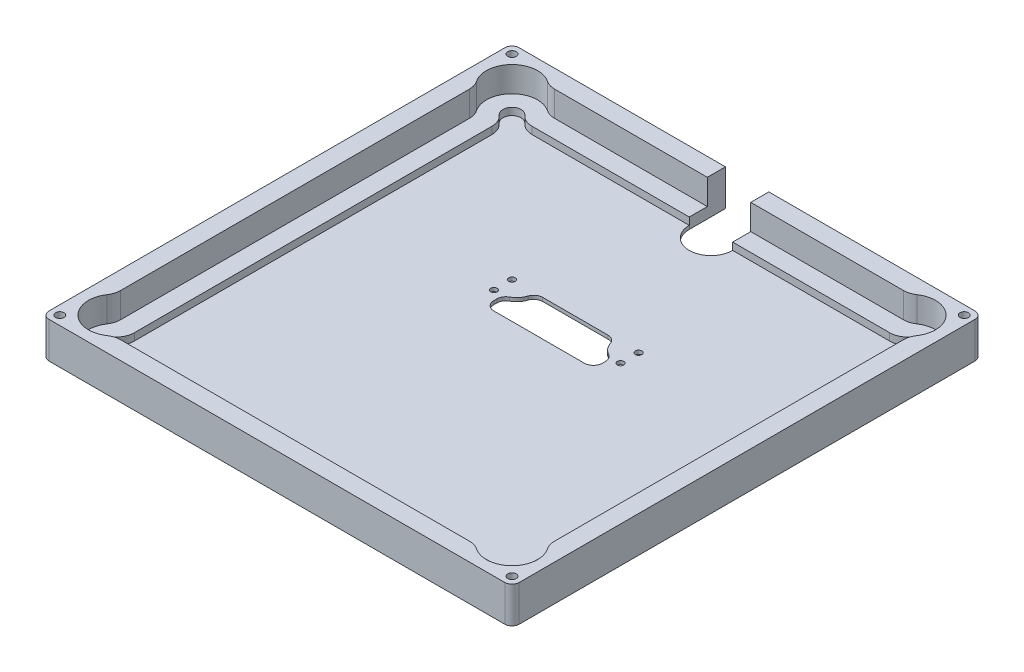
from build123d import *

# Parameters (mm, degrees)
SKETCH2_W           = 165.1
SKETCH2_H           = 165.1
BOSS_EXTRUDE1_DEPTH = 12.7
SKETCH3_W           = 152.4
SKETCH3_H           = 152.4
CUT_EXTRUDE1_DEPTH  = 8.9027
SKETCH4_W           = 139.7
SKETCH4_H           = 139.7
CUT_EXTRUDE2_DEPTH  = 2.54
SKETCH5_R           = 1.1303
CUT_EXTRUDE4_DEPTH  = 234.766882563
SKETCH6_R           = 1.4732
CUT_EXTRUDE5_DEPTH  = 234.831798522
FILLET2_R           = 2.54
CUT_EXTRUDE6_DEPTH  = 234.831798522
CUT_EXTRUDE11_DEPTH = 8.9027
SKETCH9_R           = 3.175
CUT_EXTRUDE12_DEPTH = 2.54
FILLET3_R           = 6.35
FILLET4_R           = 6.35
FILLET5_START       = -1
FILLET5_DEPTH       = 3
FILLET6_R           = 3.175


with BuildPart() as part:
    # Sketch2 → Boss-Extrude1 (new body)
    with BuildSketch(Plane(origin=(0, 0, 0), x_dir=(1, 0, 0), z_dir=(0, 1, 0))):
        with Locations((82.55, 82.55)):
            Rectangle(SKETCH2_W, SKETCH2_H)
    extrude(amount=BOSS_EXTRUDE1_DEPTH)

    # Sketch3 → Cut-Extrude1 (cut)
    with BuildSketch(Plane(origin=(0, 12.7, 0), x_dir=(1, 0, 0), z_dir=(0, 1, 0))):
        with Locations((82.55, 82.55)):
            Rectangle(SKETCH3_W, SKETCH3_H)
    extrude(amount=-CUT_EXTRUDE1_DEPTH, mode=Mode.SUBTRACT)

    # Sketch4 → Cut-Extrude2 (cut)
    with BuildSketch(Plane(origin=(0, 3.7973, 0), x_dir=(1, 0, 0), z_dir=(0, 1, 0))):
        with Locations((82.55, 82.55)):
            Rectangle(SKETCH4_W, SKETCH4_H)
    extrude(amount=-CUT_EXTRUDE2_DEPTH, mode=Mode.SUBTRACT)

    # Sketch5 → Cut-Extrude4 (cut, through all)
    with BuildSketch(Plane(origin=(0, 1.2573, 0), x_dir=(1, 0, 0), z_dir=(0, 1, 0))):
        with BuildLine():
            Line((93.98, 104.775), (71.12, 104.775))
            ThreePointArc((71.12, 104.775), (67.945, 101.6), (71.12, 98.425))
            Line((71.12, 98.425), (93.98, 98.425))
            ThreePointArc((93.98, 98.425), (97.155, 101.6), (93.98, 104.775))
        make_face()
        with Locations(Location((60.325, 98.425, 0), (0, 0, 270))):
            Circle(SKETCH5_R)
        with Locations(Location((104.775, 98.425, 0), (0, 0, 270))):
            Circle(SKETCH5_R)
        Polygon((101.6, 98.425), (93.98, 98.425), (71.12, 98.425), (63.5, 98.425), (63.5, 92.075), (101.6, 92.075), align=None)
        with Locations(Location((60.325, 104.775, 0), (0, 0, 270))):
            Circle(SKETCH5_R)
        with Locations(Location((104.775, 104.775, 0), (0, 0, 90))):
            Circle(SKETCH5_R)
    extrude(amount=-CUT_EXTRUDE4_DEPTH, mode=Mode.SUBTRACT)

    # Sketch6 → Cut-Extrude5 (cut, through all)
    with BuildSketch(Plane(origin=(0, 12.7, 0), x_dir=(1, 0, 0), z_dir=(0, 1, 0))):
        with Locations(Location((3.175, 161.925, 0), (0, 0, 270))):
            Circle(SKETCH6_R)
        with Locations(Location((161.925, 161.925, 0), (0, 0, 90))):
            Circle(SKETCH6_R)
        with Locations(Location((161.925, 3.175, 0), (0, 0, 270))):
            Circle(SKETCH6_R)
        with Locations(Location((3.175, 3.175, 0), (0, 0, 90))):
            Circle(SKETCH6_R)
    extrude(amount=-CUT_EXTRUDE5_DEPTH, mode=Mode.SUBTRACT)

    # Fillet2
    fillet2_edges = [part.edges().sort_by_distance(p)[0] for p in [
        (0, 6.35, -165.1),
        (165.1, 6.35, -165.1),
        (165.1, 6.35, 0),
        (0, 6.35, 0),
    ]]
    fillet(fillet2_edges, radius=FILLET2_R)

    # Sketch7 → Cut-Extrude6 (cut, through all)
    with BuildSketch(Plane(origin=(0, 12.7, 0), x_dir=(1, 0, 0), z_dir=(0, 1, 0))):
        with BuildLine():
            Line((74.93, 152.4), (74.93, 165.1))
            ThreePointArc((74.93, 165.1), (82.55, 172.72), (90.17, 165.1))
            Line((90.17, 165.1), (90.17, 152.4))
            ThreePointArc((90.17, 152.4), (82.55, 144.78), (74.93, 152.4))
        make_face()
    extrude(amount=-CUT_EXTRUDE6_DEPTH, mode=Mode.SUBTRACT)

    # Sketch8 → Cut-Extrude11 (cut)
    with BuildSketch(Plane(origin=(0, 12.7, 0), x_dir=(1, 0, 0), z_dir=(0, 1, 0))):
        with BuildLine():
            Line((6.35, 152.4), (6.35, 158.75))
            ThreePointArc((6.35, 158.75), (3.719743879, 152.4), (6.35, 146.05))
            Line((6.35, 146.05), (6.35, 152.4))
        make_face()
        with BuildLine():
            ThreePointArc((19.05, 158.75), (12.7, 161.380256121), (6.35, 158.75))
            Line((6.35, 158.75), (12.7, 158.75))
            Line((12.7, 158.75), (19.05, 158.75))
        make_face()
        with BuildLine():
            Line((6.35, 12.7), (6.35, 19.05))
            ThreePointArc((6.35, 19.05), (3.719743879, 12.7), (6.35, 6.35))
            Line((6.35, 6.35), (6.35, 12.7))
        make_face()
        with BuildLine():
            Line((12.7, 6.35), (6.35, 6.35))
            ThreePointArc((6.35, 6.35), (12.7, 3.719743879), (19.05, 6.35))
            Line((19.05, 6.35), (12.7, 6.35))
        make_face()
        with BuildLine():
            Line((152.4, 6.35), (146.05, 6.35))
            ThreePointArc((146.05, 6.35), (152.4, 3.719743879), (158.75, 6.35))
            Line((158.75, 6.35), (152.4, 6.35))
        make_face()
        with BuildLine():
            ThreePointArc((161.380256121, 12.7), (160.696674827, 16.136595236), (158.75, 19.05))
            Line((158.75, 19.05), (158.75, 12.7))
            Line((158.75, 12.7), (158.75, 6.35))
            ThreePointArc((158.75, 6.35), (160.696674827, 9.263404764), (161.380256121, 12.7))
        make_face()
        with BuildLine():
            Line((158.75, 152.4), (158.75, 146.05))
            ThreePointArc((158.75, 146.05), (160.696674827, 148.963404764), (161.380256121, 152.4))
            ThreePointArc((161.380256121, 152.4), (160.696674827, 155.836595236), (158.75, 158.75))
            Line((158.75, 158.75), (158.75, 152.4))
        make_face()
        with BuildLine():
            ThreePointArc((158.75, 158.75), (152.4, 161.380256121), (146.05, 158.75))
            Line((146.05, 158.75), (152.4, 158.75))
            Line((152.4, 158.75), (158.75, 158.75))
        make_face()
    extrude(amount=-CUT_EXTRUDE11_DEPTH, mode=Mode.SUBTRACT)

    # Sketch9 → Cut-Extrude12 (cut)
    with BuildSketch(Plane(origin=(0, 3.7973, 0), x_dir=(1, 0, 0), z_dir=(0, 1, 0))):
        with Locations((12.7, 152.4)):
            Circle(SKETCH9_R)
        with Locations((152.4, 152.4)):
            Circle(SKETCH9_R)
        with Locations((152.4, 12.7)):
            Circle(SKETCH9_R)
        with Locations((12.7, 12.7)):
            Circle(SKETCH9_R)
    extrude(amount=-CUT_EXTRUDE12_DEPTH, mode=Mode.SUBTRACT)

    # Fillet3
    fillet3_edges = [part.edges().sort_by_distance(p)[0] for p in [
        (149.225, 2.5273, -12.7),
        (15.875, 2.5273, -12.7),
        (152.4, 2.5273, -149.225),
        (12.7, 2.5273, -149.225),
        (12.7, 2.5273, -15.875),
        (152.4, 2.5273, -15.875),
        (149.225, 2.5273, -152.4),
        (15.875, 2.5273, -152.4),
    ]]
    fillet(fillet3_edges, radius=FILLET3_R)

    # Fillet4
    fillet4_edges = [part.edges().sort_by_distance(p)[0] for p in [
        (146.05, 8.24865, -158.75),
        (146.05, 8.24865, -6.35),
        (19.05, 8.24865, -6.35),
        (6.35, 8.24865, -146.05),
        (19.05, 8.24865, -158.75),
        (6.35, 8.24865, -19.05),
        (158.75, 8.24865, -19.05),
        (158.75, 8.24865, -146.05),
    ]]
    fillet(fillet4_edges, radius=FILLET4_R)

    # Fillet5: read off the stored shape, not the designer's step
    # Fillet5 outline → Fillet5 (cut)
    with BuildSketch(Plane(origin=(0, 0, 0), x_dir=(1, 0, 0), z_dir=(0, 1, 0)).offset(FILLET5_START)):
        with BuildLine():
            ThreePointArc((101.6, 98.425), (98.748828907, 99.911991034), (96.991709431, 102.605102634))
            ThreePointArc((96.991709431, 102.605102634), (96.556026578, 99.744006447), (93.98, 98.425))
            Line((93.98, 98.425), (101.6, 98.425))
        make_face()
        with BuildLine():
            ThreePointArc((68.108290569, 102.605102634), (66.351171093, 99.911991034), (63.5, 98.425))
            Line((63.5, 98.425), (71.12, 98.425))
            ThreePointArc((71.12, 98.425), (68.543973422, 99.744006447), (68.108290569, 102.605102634))
        make_face()
    extrude(amount=FILLET5_DEPTH, mode=Mode.SUBTRACT)

    # Fillet6
    fillet6_edges = [part.edges().sort_by_distance(p)[0] for p in [
        (101.6, 0.62865, -98.425),
        (101.6, 0.62865, -92.075),
        (63.5, 0.62865, -92.075),
        (63.5, 0.62865, -98.425),
    ]]
    fillet(fillet6_edges, radius=FILLET6_R)


solid = part.part
